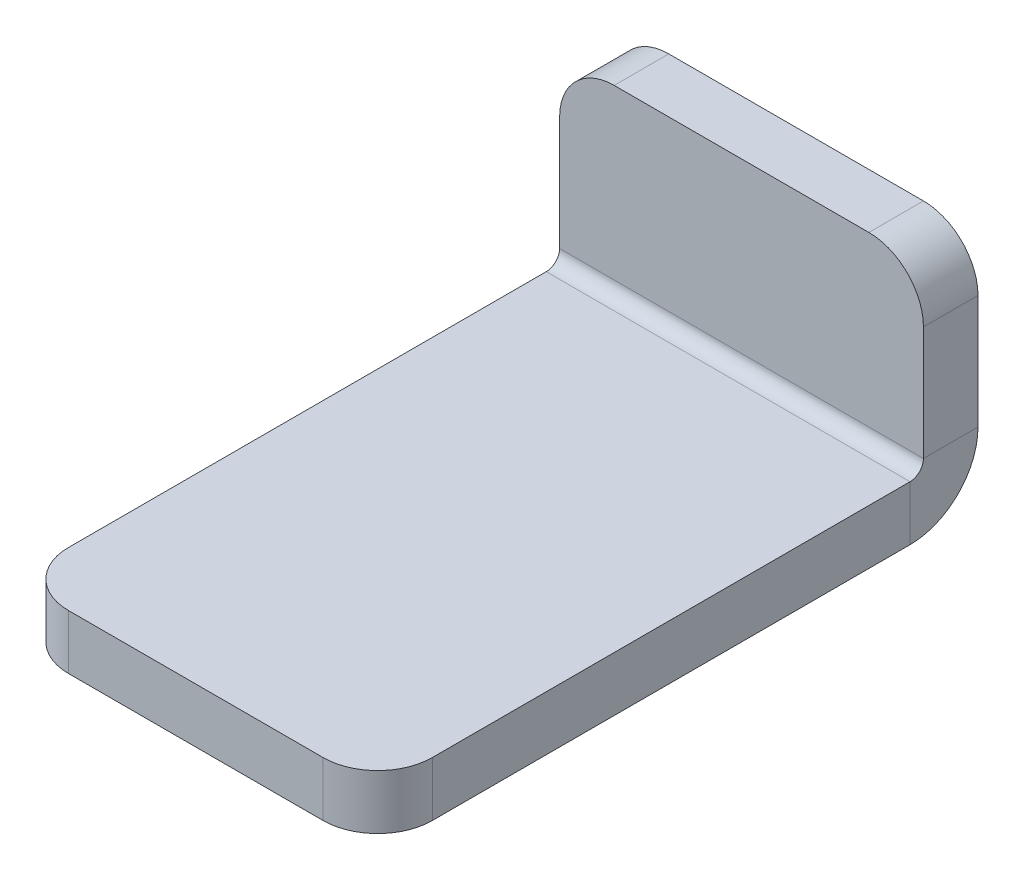
from build123d import *

# Parameters (mm, degrees)
BASE_FLANGE1_DEPTH = 20
FILLET1_R          = 3


# Sheet-metal steps are written as plain solids
with BuildPart() as part:
    # Sketch1 → Base-Flange1 (new body)
    with BuildSketch(Plane(origin=(0, 0, 0), x_dir=(0, 0, -1), z_dir=(1, 0, 0))):
        with BuildLine():
            Line((0, 0), (29.2634, 0))
            ThreePointArc((29.2634, 0), (29.784254855, 0.215745145), (30, 0.7366))
            Line((30, 0.7366), (30, 10))
            Line((30, 10), (33, 10))
            Line((33, 10), (33, 0.7366))
            ThreePointArc((33, 0.7366), (31.905575199, -1.905575199), (29.2634, -3))
            Line((29.2634, -3), (0, -3))
            Line((0, -3), (0, 0))
        make_face()
    extrude(amount=BASE_FLANGE1_DEPTH)

    # Fillet1
    fillet1_edges = [part.edges().sort_by_distance(p)[0] for p in [
        (20, -1.5, 0),
        (20, 10, -31.5),
        (0, -1.5, 0),
        (0, 10, -31.5),
    ]]
    fillet(fillet1_edges, radius=FILLET1_R)


solid = part.part
